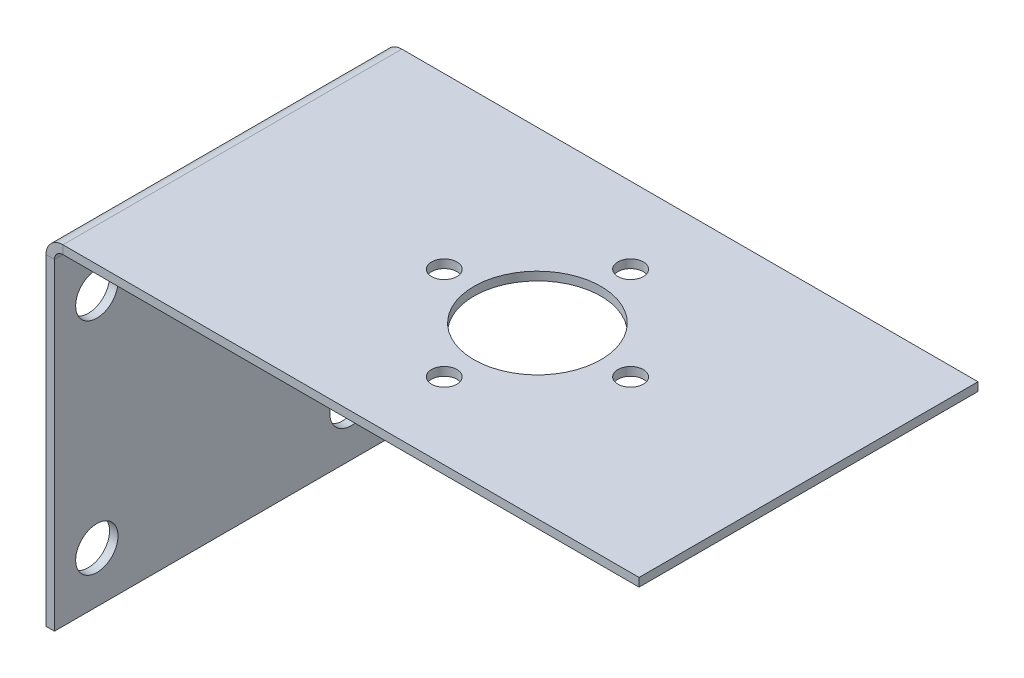
from build123d import *

# Parameters (mm, degrees)
BASE_FLANGE1_DEPTH = 40
CUT_EXTRUDE1_REACH = 92
SKETCH6_R          = 7.5
SKETCH7_R          = 1.5
CUT_EXTRUDE2_DEPTH = 91
CUT_EXTRUDE3_REACH = 92
SKETCH8_R          = 2.5


# Sheet-metal steps are written as plain solids
with BuildPart() as part:
    # Sketch1 → Base-Flange1 (new body)
    with BuildSketch(Plane.XY):
        with BuildLine():
            Line((0, 0), (0, 38))
            ThreePointArc((0, 38), (0.585786438, 39.414213562), (2, 40))
            Line((2, 40), (70, 40))
            Line((70, 40), (70, 39))
            Line((70, 39), (2, 39))
            ThreePointArc((2, 39), (1.292893219, 38.707106781), (1, 38))
            Line((1, 38), (1, 0))
            Line((1, 0), (0, 0))
        make_face()
    extrude(amount=BASE_FLANGE1_DEPTH)

    # Sketch6 → Cut-Extrude1 (cut, up to next)
    with BuildSketch(Plane(origin=(0, 40, 0), x_dir=(1, 0, 0), z_dir=(0, 1, 0)), mode=Mode.PRIVATE) as cut_extrude1_sk1:
        with Locations(Location((38, -20, 0), (0, 0, 270))):
            Circle(SKETCH6_R)
    cut_extrude1_tool1 = extrude(cut_extrude1_sk1.sketch, amount=-CUT_EXTRUDE1_REACH, mode=Mode.PRIVATE) & part.part
    add(cut_extrude1_tool1.solids().sort_by_distance((38, 40, 20))[0], mode=Mode.SUBTRACT)

    # Sketch7 → Cut-Extrude2 (cut, through all)
    with BuildSketch(Plane(origin=(0, 40, 0), x_dir=(1, 0, 0), z_dir=(0, 1, 0))):
        with Locations(Location((49, -20, 0), (0, 0, 270))):
            Circle(SKETCH7_R)
        with Locations(Location((38, -31, 0), (0, 0, 270))):
            Circle(SKETCH7_R)
        with Locations(Location((27, -20, 0), (0, 0, 270))):
            Circle(SKETCH7_R)
        with Locations(Location((38, -9, 0), (0, 0, 270))):
            Circle(SKETCH7_R)
    extrude(amount=-CUT_EXTRUDE2_DEPTH, mode=Mode.SUBTRACT)

    # Sketch8 → Cut-Extrude3 (cut, up to next)
    with BuildSketch(Plane.ZY, mode=Mode.PRIVATE) as cut_extrude3_sk1:
        with Locations((5, 32)):
            Circle(SKETCH8_R)
    cut_extrude3_tool1 = extrude(cut_extrude3_sk1.sketch, amount=-CUT_EXTRUDE3_REACH, mode=Mode.PRIVATE) & part.part
    # Sketch8 → Cut-Extrude3 (cut, up to next)
    with BuildSketch(Plane.ZY, mode=Mode.PRIVATE) as cut_extrude3_sk2:
        with Locations((5, 6)):
            Circle(SKETCH8_R)
    cut_extrude3_tool2 = extrude(cut_extrude3_sk2.sketch, amount=-CUT_EXTRUDE3_REACH, mode=Mode.PRIVATE) & part.part
    # Sketch8 → Cut-Extrude3 (cut, up to next)
    with BuildSketch(Plane.ZY, mode=Mode.PRIVATE) as cut_extrude3_sk3:
        with Locations((35, 6)):
            Circle(SKETCH8_R)
    cut_extrude3_tool3 = extrude(cut_extrude3_sk3.sketch, amount=-CUT_EXTRUDE3_REACH, mode=Mode.PRIVATE) & part.part
    # Sketch8 → Cut-Extrude3 (cut, up to next)
    with BuildSketch(Plane.ZY, mode=Mode.PRIVATE) as cut_extrude3_sk4:
        with Locations((35, 32)):
            Circle(SKETCH8_R)
    cut_extrude3_tool4 = extrude(cut_extrude3_sk4.sketch, amount=-CUT_EXTRUDE3_REACH, mode=Mode.PRIVATE) & part.part
    add(cut_extrude3_tool1.solids().sort_by_distance((0, 32, 5))[0], mode=Mode.SUBTRACT)
    add(cut_extrude3_tool2.solids().sort_by_distance((0, 6, 5))[0], mode=Mode.SUBTRACT)
    add(cut_extrude3_tool3.solids().sort_by_distance((0, 6, 35))[0], mode=Mode.SUBTRACT)
    add(cut_extrude3_tool4.solids().sort_by_distance((0, 32, 35))[0], mode=Mode.SUBTRACT)


solid = part.part
